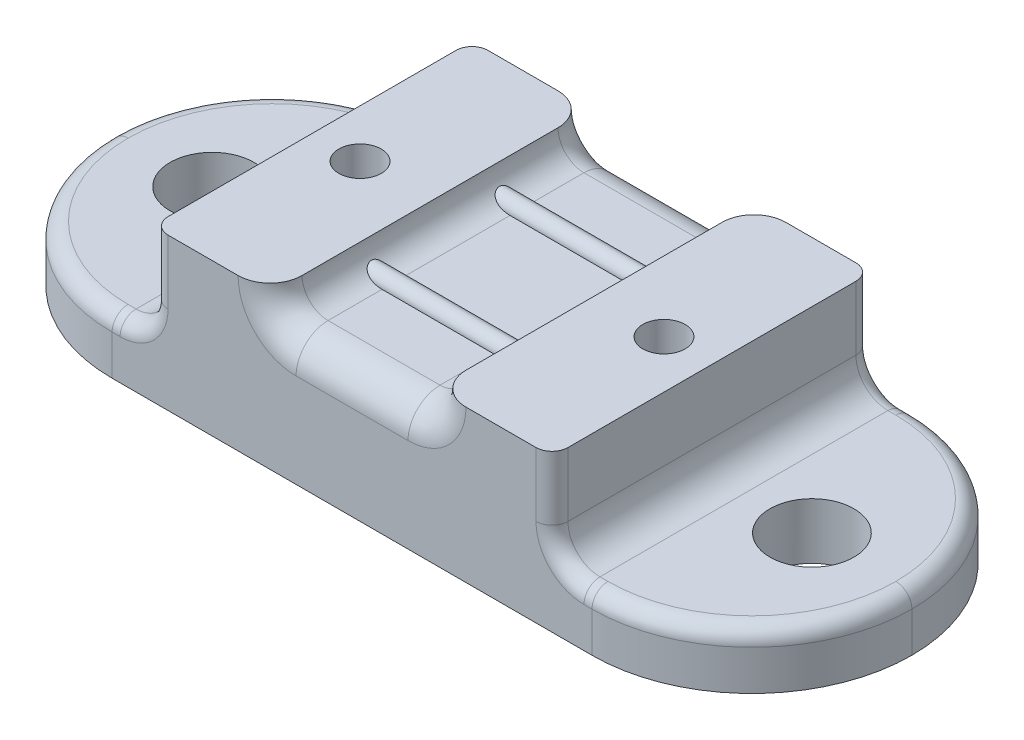
from build123d import *

# Parameters (mm, degrees)
SKETCH1_W           = 50
SKETCH1_H           = 20
BOSS_EXTRUDE1_DEPTH = 3.5
SKETCH2_W           = 25
SKETCH2_H           = 20
BOSS_EXTRUDE2_DEPTH = 6
SKETCH3_R           = 2.625
CUT_EXTRUDE1_DEPTH  = 6
CUT_EXTRUDE2_DEPTH  = 50
SKETCH5_R           = 1.325
CUT_EXTRUDE3_DEPTH  = 7
FILLET1_R           = 10
FILLET2_R           = 2
SKETCH6_R           = 0.625
BOSS_EXTRUDE3_DEPTH = 25
FILLET3_R           = 2
FILLET4_R           = 1


with BuildPart() as part:
    # Sketch1 → Boss-Extrude1 (new body)
    with BuildSketch(Plane(origin=(0, 0, 0), x_dir=(1, 0, 0), z_dir=(0, 1, 0))):
        with Locations((25, 10)):
            Rectangle(SKETCH1_W, SKETCH1_H)
    extrude(amount=BOSS_EXTRUDE1_DEPTH)

    # Sketch2 → Boss-Extrude2 (add)
    with BuildSketch(Plane(origin=(0, 3.5, 0), x_dir=(1, 0, 0), z_dir=(0, 1, 0))):
        with Locations((25, 10)):
            Rectangle(SKETCH2_W, SKETCH2_H)
    extrude(amount=BOSS_EXTRUDE2_DEPTH)

    # Sketch3 → Cut-Extrude1 (cut)
    with BuildSketch(Plane(origin=(0, 3.5, 0), x_dir=(1, 0, 0), z_dir=(0, 1, 0))):
        with Locations(Location((6.25, 10, 0), (0, 0, 270))):
            Circle(SKETCH3_R)
        with Locations(Location((43.75, 10, 0), (0, 0, 270))):
            Circle(SKETCH3_R)
    extrude(amount=-CUT_EXTRUDE1_DEPTH, mode=Mode.SUBTRACT)

    # Sketch4 → Cut-Extrude2 (cut)
    with BuildSketch(Plane.XY):
        with BuildLine():
            Line((21.5, 11.125), (28.5, 11.125))
            ThreePointArc((28.5, 11.125), (30.125, 9.5), (28.5, 7.875))
            Line((28.5, 7.875), (21.5, 7.875))
            ThreePointArc((21.5, 7.875), (19.875, 9.5), (21.5, 11.125))
        make_face()
    extrude(amount=-CUT_EXTRUDE2_DEPTH, mode=Mode.SUBTRACT)

    # Sketch5 → Cut-Extrude3 (cut)
    with BuildSketch(Plane(origin=(0, 9.5, 0), x_dir=(1, 0, 0), z_dir=(0, 1, 0))):
        with Locations(Location((15.5, 10, 0), (0, 0, 270))):
            Circle(SKETCH5_R)
        with Locations(Location((34.5, 10, 0), (0, 0, 270))):
            Circle(SKETCH5_R)
    extrude(amount=-CUT_EXTRUDE3_DEPTH, mode=Mode.SUBTRACT)

    # Fillet1
    fillet1_edges = [part.edges().sort_by_distance(p)[0] for p in [
        (0, 1.75, -20),
        (0, 1.75, 0),
        (50, 1.75, -20),
        (50, 1.75, 0),
    ]]
    fillet(fillet1_edges, radius=FILLET1_R - 0.0001)  # a hair under: the kernel refuses the full size

    # Fillet2
    fillet2_edges = [part.edges().sort_by_distance(p)[0] for p in [
        (12.5, 3.5, -10),
        (37.5, 3.5, -10),
    ]]
    fillet(fillet2_edges, radius=FILLET2_R)

    # Sketch6 → Boss-Extrude3 (add)
    with BuildSketch(Plane(origin=(37.5, 0, 0), x_dir=(0, 0, -1), z_dir=(1, 0, 0))):
        with Locations((6, 7.875)):
            Circle(SKETCH6_R)
        with Locations((14, 7.875)):
            Circle(SKETCH6_R)
    extrude(amount=-BOSS_EXTRUDE3_DEPTH)

    # Fillet3
    fillet3_edges = [part.edges().sort_by_distance(p)[0] for p in [
        (25, 7.875, -20),
        (20.350951481, 8.350951481, -20),
        (29.649048519, 8.350951481, -20),
        (20.350951481, 8.350951481, 0),
        (25, 7.875, 0),
        (29.649048519, 8.350951481, 0),
    ]]
    fillet(fillet3_edges, radius=FILLET3_R)

    # Fillet4
    fillet4_edges = [part.edges().sort_by_distance(p)[0] for p in [
        (12.5, 7.5, -20),
        (12.5, 7.5, 0),
        (37.5, 7.5, 0),
        (37.5, 7.5, -20),
        (39.75005, 3.5, -20),
        (10.24995, 3.5, 0),
        (2.928902899, 3.5, -2.928902899),
        (2.928902899, 3.5, -17.071097101),
        (47.071097101, 3.5, -2.928902899),
        (47.071097101, 3.5, -17.071097101),
        (39.75005, 3.5, 0),
        (10.24995, 3.5, -20),
        (38.085786438, 4.085786438, -20),
        (38.085786438, 4.085786438, 0),
        (11.914213562, 4.085786438, 0),
        (11.914213562, 4.085786438, -20),
    ]]
    fillet(fillet4_edges, radius=FILLET4_R)


solid = part.part
